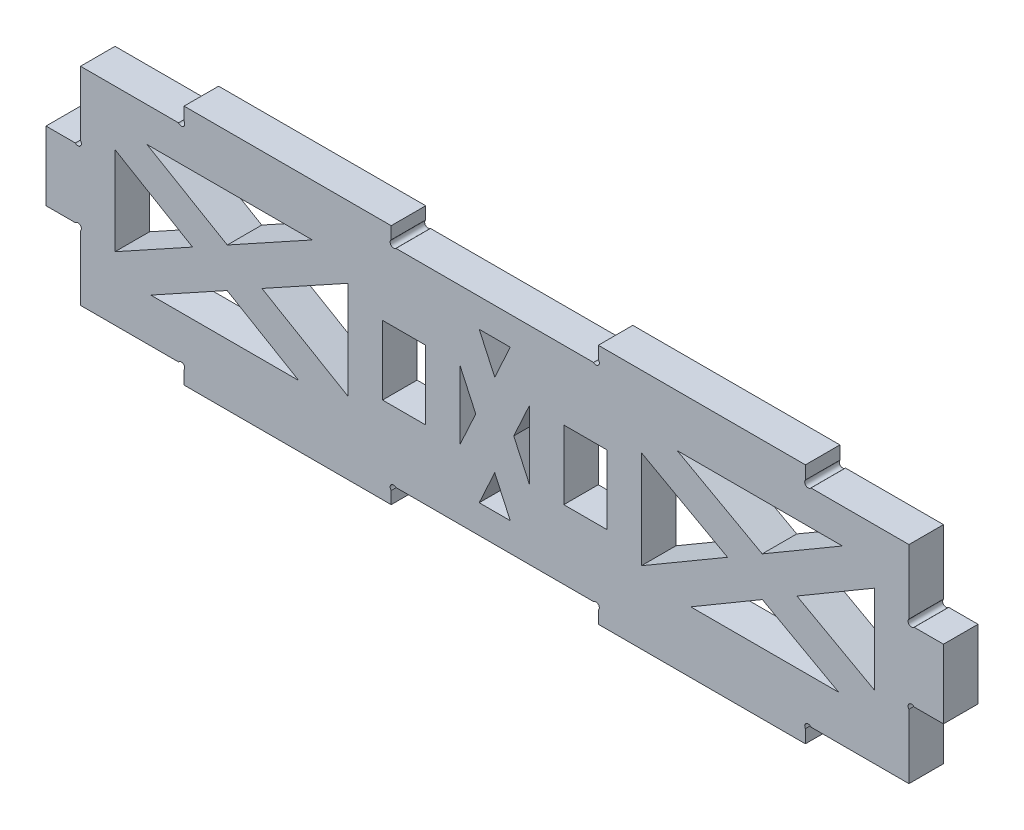
from build123d import *

# Parameters (mm, degrees)
SKETCH1_W           = 330.2
SKETCH1_H           = 76.2
BOSS_EXTRUDE1_DEPTH = 12.7
SKETCH2_W           = 76.2
SKETCH2_H           = 6.35
BOSS_EXTRUDE2_DEPTH = 12.7
SKETCH3_W           = 12.7
SKETCH3_H           = 25.4
SKETCH3_W_2         = 15.875
CUT_EXTRUDE1_DEPTH  = 172.45
CUT_EXTRUDE2_DEPTH  = 172.45
SKETCH7_R           = 1.27
CUT_EXTRUDE4_DEPTH  = 172.45


with BuildPart() as part:
    # Sketch1 → Boss-Extrude1 (new body)
    with BuildSketch(Plane.XY):
        Rectangle(SKETCH1_W, SKETCH1_H)
    extrude(amount=BOSS_EXTRUDE1_DEPTH)

    # Sketch2 → Boss-Extrude2 (add)
    with BuildSketch(Plane.XY.offset(12.7)):
        with Locations((-76.2, -41.275)):
            Rectangle(SKETCH2_W, SKETCH2_H)
        with Locations((76.2, -41.275)):
            Rectangle(SKETCH2_W, SKETCH2_H)
        with Locations((76.2, 41.275)):
            Rectangle(SKETCH2_W, SKETCH2_H)
        with Locations((-76.2, 41.275)):
            Rectangle(SKETCH2_W, SKETCH2_H)
    extrude(amount=-BOSS_EXTRUDE2_DEPTH)

    # Sketch3 → Cut-Extrude1 (cut, through all)
    with BuildSketch(Plane.XY.offset(12.7)):
        with Locations((-158.75, -25.4)):
            Rectangle(SKETCH3_W, SKETCH3_H)
        with Locations((-158.75, 25.4)):
            Rectangle(SKETCH3_W, SKETCH3_H)
        with Locations((158.75, 25.4)):
            Rectangle(SKETCH3_W, SKETCH3_H)
        with Locations((158.75, -25.4)):
            Rectangle(SKETCH3_W, SKETCH3_H)
        with Locations((33.3375, 0)):
            Rectangle(SKETCH3_W_2, SKETCH3_H)
        with Locations((-33.3375, 0)):
            Rectangle(SKETCH3_W_2, SKETCH3_H)
    extrude(amount=-CUT_EXTRUDE1_DEPTH, mode=Mode.SUBTRACT)

    # Sketch4 → Cut-Extrude2 (cut, through all)
    with BuildSketch(Plane.XY.offset(12.7)):
        Polygon((-98.459533988, -6.395545943), (-126.555106965, -21.896551724), (-72.104902526, -21.896551724), align=None)
        Polygon((-139.7, 17.860862384), (-139.7, -14.644196946), (-111.184144119, 1.088689057), align=None)
        Polygon((-85.651314146, 0.671058107), (-53.975, -17.860862384), (-53.975, 18.147645222), align=None)
        Polygon((-67.119893035, 25.4), (-127.920097474, 25.4), (-98.410958103, 8.1359641), align=None)
        Polygon((53.975, -17.860862384), (85.651314146, 0.671058107), (53.975, 18.147645222), align=None)
        Polygon((98.459533988, -6.395545943), (72.104902526, -21.896551724), (126.555106965, -21.896551724), align=None)
        Polygon((127.920097474, 25.4), (67.119893035, 25.4), (98.410958103, 8.1359641), align=None)
        Polygon((111.184144119, 1.088689057), (139.7, -14.644196946), (139.7, 17.860862384), align=None)
        Polygon((-6.988546096, 0), (-12.7, 12.427106699), (-12.7, -12.427106699), align=None)
        Polygon((5.711453904, -27.632938607), (0, -15.205831908), (-5.711453904, -27.632938607), align=None)
        Polygon((-5.711453904, 27.632938607), (0, 15.205831908), (5.711453904, 27.632938607), align=None)
        Polygon((12.7, 12.427106699), (6.988546096, 0), (12.7, -12.427106699), align=None)
    extrude(amount=-CUT_EXTRUDE2_DEPTH, mode=Mode.SUBTRACT)

    # Sketch7 → Cut-Extrude4 (cut, through all)
    with BuildSketch(Plane.XY.offset(12.7)):
        with Locations((-153.357161978, -13.534710098)):
            Circle(SKETCH7_R)
        with Locations((-115.322216931, -38.853639533)):
            Circle(SKETCH7_R)
        with Locations((-37.219883345, -39.015584335)):
            Circle(SKETCH7_R)
        with Locations((37.219883345, -39.015584335)):
            Circle(SKETCH7_R)
        with Locations((115.322216931, -38.853639533)):
            Circle(SKETCH7_R)
        with Locations((153.357161978, -13.534710098)):
            Circle(SKETCH7_R)
        with Locations((153.357161978, 13.534710098)):
            Circle(SKETCH7_R)
        with Locations((115.322216931, 38.853639533)):
            Circle(SKETCH7_R)
        with Locations((37.219883345, 39.015584335)):
            Circle(SKETCH7_R)
        with Locations((-37.219883345, 39.015584335)):
            Circle(SKETCH7_R)
        with Locations((-115.322216931, 38.853639533)):
            Circle(SKETCH7_R)
        with Locations((-153.357161978, 13.534710098)):
            Circle(SKETCH7_R)
    extrude(amount=-CUT_EXTRUDE4_DEPTH, mode=Mode.SUBTRACT)


solid = part.part
